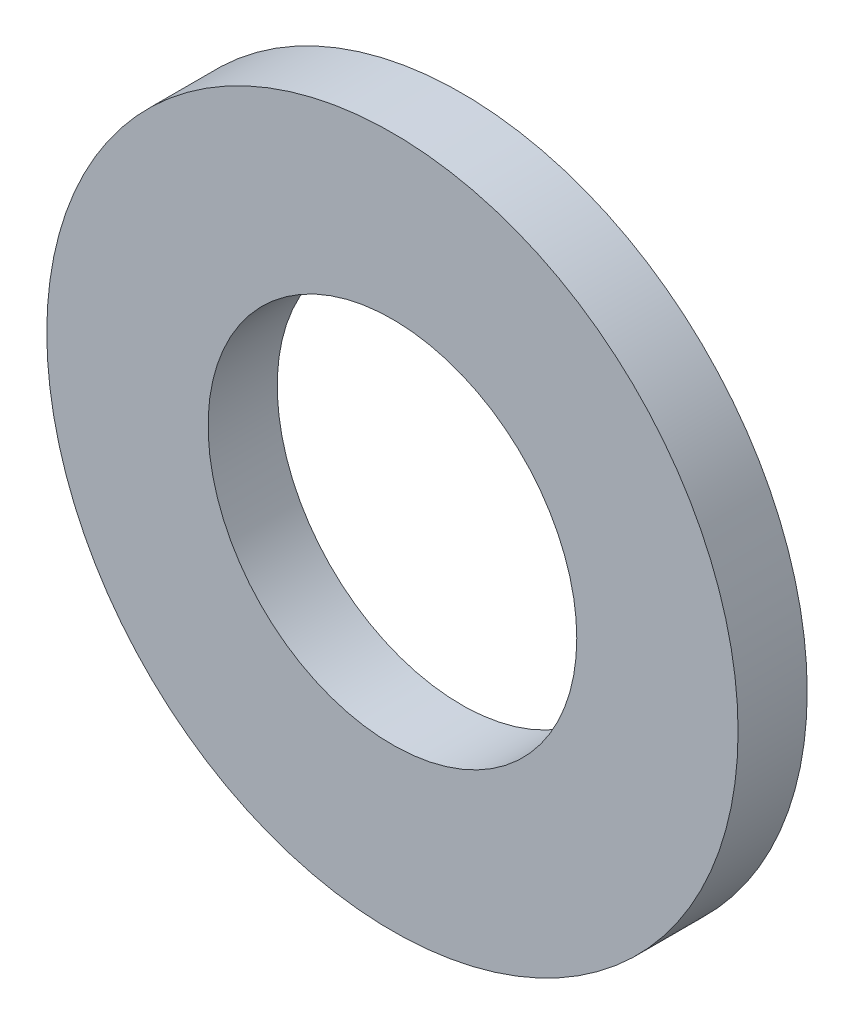
from build123d import *

# Parameters (mm, degrees)
SKETCH1_R           = 3
SKETCH1_R_2         = 1.6
BOSS_EXTRUDE1_DEPTH = 0.6


with BuildPart() as part:
    # Sketch1 → Boss-Extrude1 (new body)
    with BuildSketch(Plane.XY):
        Circle(SKETCH1_R)
        Circle(SKETCH1_R_2, mode=Mode.SUBTRACT)
    extrude(amount=BOSS_EXTRUDE1_DEPTH)


solid = part.part
